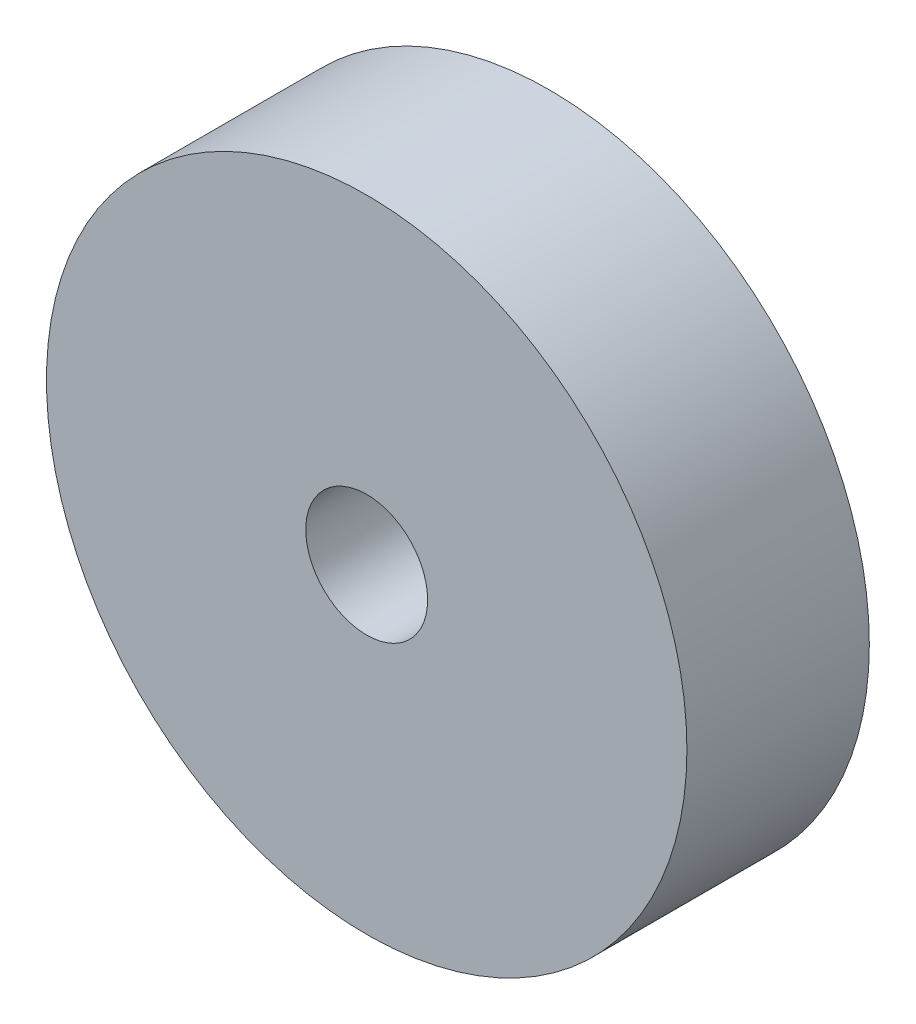
from build123d import *

# Parameters (mm, degrees)
SKETCH1_R           = 9.80909091
SKETCH1_R_2         = 1.8669
BOSS_EXTRUDE1_DEPTH = 5.588


with BuildPart() as part:
    # Sketch1 → Boss-Extrude1 (new body)
    with BuildSketch(Plane.XY):
        Circle(SKETCH1_R)
        Circle(SKETCH1_R_2, mode=Mode.SUBTRACT)
    extrude(amount=BOSS_EXTRUDE1_DEPTH)


solid = part.part
